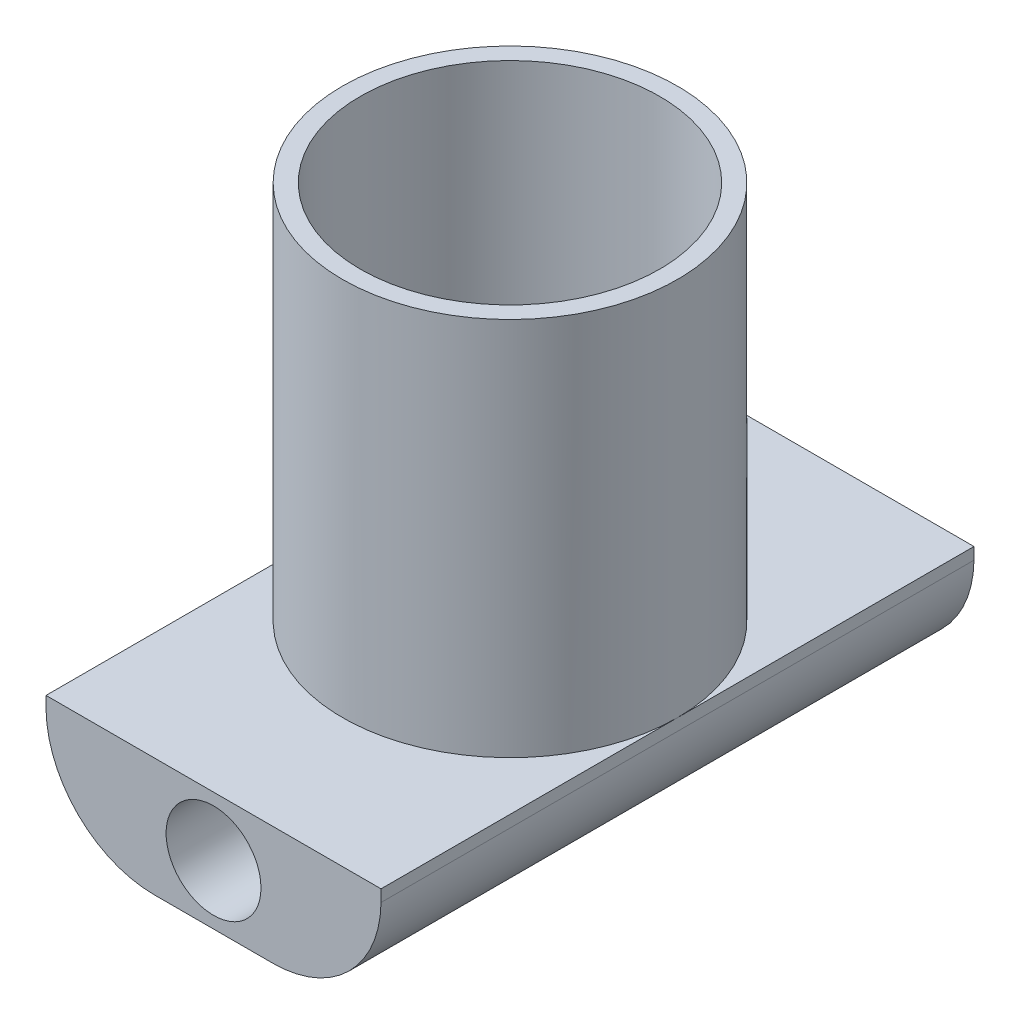
from build123d import *

# Parameters (mm, degrees)
SKETCH1_R                = 14.125
SKETCH1_R_2              = 12.625
BOSS_EXTRUDE1_DEPTH      = 30
BOSS_EXTRUDE2_START      = 3
SKETCH2_R                = 14.125
BOSS_EXTRUDE2_DEPTH      = 3
BOSS_EXTRUDE3_DEPTH      = 25
BOSS_EXTRUDE3_DEPTH_BACK = 25
SKETCH3_R                = 4


with BuildPart() as part:
    # Sketch1 → Boss-Extrude1 (new body)
    with BuildSketch(Plane(origin=(0, 0, 0), x_dir=(1, 0, 0), z_dir=(0, 1, 0))):
        Circle(SKETCH1_R)
        Circle(SKETCH1_R_2, mode=Mode.SUBTRACT)
    extrude(amount=BOSS_EXTRUDE1_DEPTH)

    # Sketch2 → Boss-Extrude2 (add)
    with BuildSketch(Plane(origin=(0, 0, 0), x_dir=(-1, 0, 0), z_dir=(0, -1, 0)).offset(BOSS_EXTRUDE2_START)):
        Circle(SKETCH2_R)
    extrude(amount=-BOSS_EXTRUDE2_DEPTH)

    # Sketch3 → Boss-Extrude3 (add, two sides: drawn at the far end of the back side and taken through both)
    with BuildSketch(Plane.XY.offset(-BOSS_EXTRUDE3_DEPTH_BACK)):
        with BuildLine():
            Line((14.125, -2), (-14.125, -2))
            Line((-14.125, -2), (-14.125, -3))
            ThreePointArc((-14.125, -3), (-11.408307596, -9.371443813), (-5, -12))
            Line((-5, -12), (5, -12))
            ThreePointArc((5, -12), (11.408307596, -9.371443813), (14.125, -3))
            Line((14.125, -3), (14.125, -2))
        make_face()
        with Locations((0, -7)):
            Circle(SKETCH3_R, mode=Mode.SUBTRACT)
    extrude(amount=BOSS_EXTRUDE3_DEPTH + BOSS_EXTRUDE3_DEPTH_BACK)


solid = part.part
